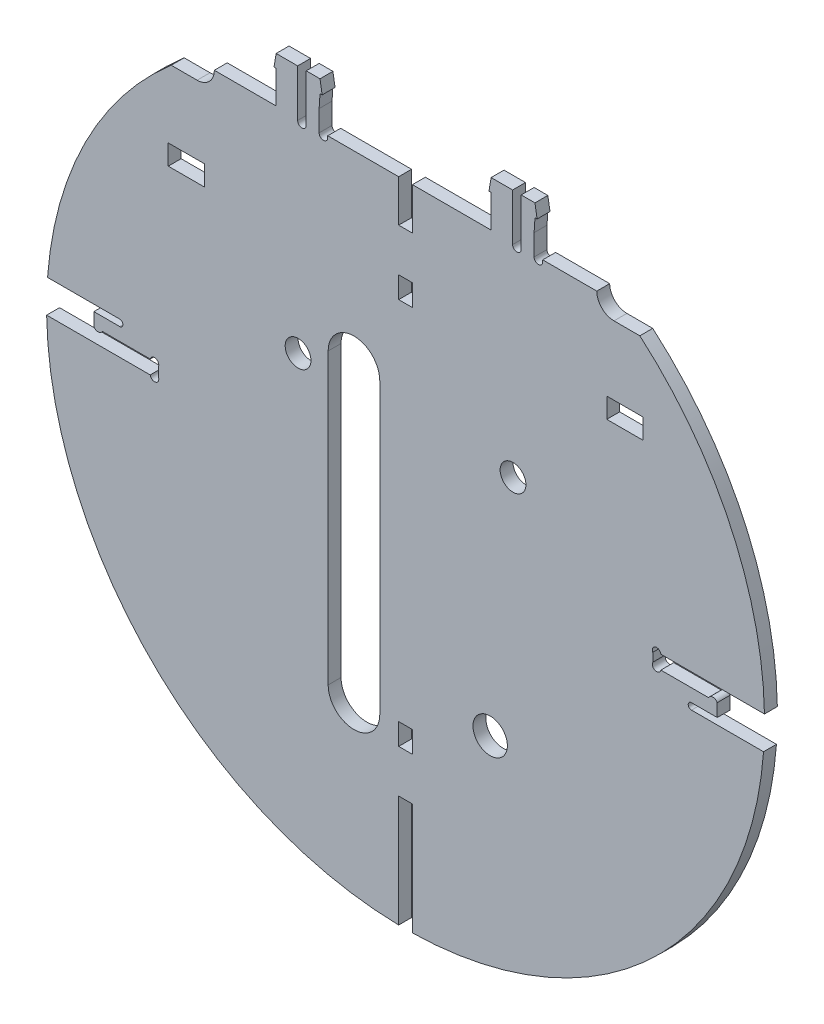
from build123d import *

# Parameters (mm, degrees)
SKETCH1_R                     = 83.5
BOSS_EXTRUDE1_DEPTH           = 3
FACE_FLATTENING_REACH         = 120.125
SKETCH10_W                    = 98.960633138
SKETCH10_H                    = 16.23969765
SIDE_RIB_SLOT_DEPTH           = 10
RIB_TAB_CLEARANCE_SLOT_REACH  = 120.125
SKETCH5_W                     = 3.2
SKETCH5_H                     = 5
SKETCH5_H_2                   = 26
SIDE_RIB_SLOT_PATTERN_COUNT   = 2
EYE_PLATE_SLOTS_REACH         = 120.104
SKETCH3_R                     = 3
SKETCH3_W                     = 8.4
SKETCH3_H                     = 4.684444021
FACE_START                    = -3
FACE_PLATE_TABS_OUTLINE_W     = 2
FACE_PLATE_TABS_OUTLINE_H     = 4.476977338
FACE_PLATE_TABS_DEPTH         = 3
SKETCH11_W                    = 2
SKETCH11_H                    = 4.476977338
FACE_PLATE_TAB_RELIEF_DEPTH   = 3
ACTUATOR_CLEARANCE_SLOT_REACH = 120.104
SKETCH4_R                     = 4
EYE_PLATE_RELIEF_REACH        = 120.104


# Read off the part's stored shape, not the designer's step: face plate tabs
with BuildPart() as part:
    # Sketch1 → Boss-Extrude1 (new body)
    with BuildSketch(Plane.XY):
        Circle(SKETCH1_R)
    extrude(amount=BOSS_EXTRUDE1_DEPTH)

    # Sketch10 → face flattening (cut, up to next)
    with BuildSketch(Plane.XY.offset(3), mode=Mode.PRIVATE) as face_flattening_sk1:
        with Locations((0, 75.380151175)):
            Rectangle(SKETCH10_W, SKETCH10_H)
    face_flattening_tool1 = extrude(face_flattening_sk1.sketch, amount=-FACE_FLATTENING_REACH, mode=Mode.PRIVATE) & part.part
    add(face_flattening_tool1.solids().sort_by_distance((0, 75.380151, 3))[0], mode=Mode.SUBTRACT)

    # Sketch7 → side rib slot (cut)
    with BuildSketch(Plane.XY.offset(3)):
        with BuildLine():
            Line((-72.5, 1.635889894), (-72.5, 4.635889894))
            Line((-72.5, 4.635889894), (-66.5, 4.635889894))
            ThreePointArc((-66.5, 4.635889894), (-65.75, 5.385889894), (-66.5, 6.135889894))
            Line((-66.5, 6.135889894), (-87.5, 6.135889894))
            Line((-87.5, 6.135889894), (-87.5, -1.564110106))
            Line((-87.5, -1.564110106), (-72.5, -1.564110106))
            Line((-72.5, -1.564110106), (-59.391745722, -1.564110106))
            ThreePointArc((-59.391745722, -1.564110106), (-58.11423896, -2.394190801), (-57.5, -1))
            Line((-57.5, -1), (-57.5, 1))
            ThreePointArc((-57.5, 1), (-58.079561495, 2.383159214), (-59.379795897, 1.635889894))
            Line((-59.379795897, 1.635889894), (-70.5, 1.635889894))
            ThreePointArc((-70.5, 1.635889894), (-71.5, 1.035889894), (-72.5, 1.635889894))
        make_face()
    side_rib_slot = extrude(amount=-SIDE_RIB_SLOT_DEPTH, mode=Mode.SUBTRACT)

    # Sketch5 → rib tab clearance slot (cut, up to next)
    with BuildSketch(Plane.XY.offset(3), mode=Mode.PRIVATE) as rib_tab_clearance_slot_sk1:
        with Locations((0, 45)):
            Rectangle(SKETCH5_W, SKETCH5_H)
    rib_tab_clearance_slot_tool1 = extrude(rib_tab_clearance_slot_sk1.sketch, amount=-RIB_TAB_CLEARANCE_SLOT_REACH, mode=Mode.PRIVATE) & part.part
    # Sketch5 → rib tab clearance slot (cut, up to next)
    with BuildSketch(Plane.XY.offset(3), mode=Mode.PRIVATE) as rib_tab_clearance_slot_sk2:
        with Locations((0, 70.5)):
            Rectangle(SKETCH5_W, SKETCH5_H_2)
    rib_tab_clearance_slot_tool2 = extrude(rib_tab_clearance_slot_sk2.sketch, amount=-RIB_TAB_CLEARANCE_SLOT_REACH, mode=Mode.PRIVATE) & part.part
    # Sketch5 → rib tab clearance slot (cut, up to next)
    with BuildSketch(Plane.XY.offset(3), mode=Mode.PRIVATE) as rib_tab_clearance_slot_sk3:
        with Locations((0, -70.5)):
            Rectangle(SKETCH5_W, SKETCH5_H_2)
    rib_tab_clearance_slot_tool3 = extrude(rib_tab_clearance_slot_sk3.sketch, amount=-RIB_TAB_CLEARANCE_SLOT_REACH, mode=Mode.PRIVATE) & part.part
    # Sketch5 → rib tab clearance slot (cut, up to next)
    with BuildSketch(Plane.XY.offset(3), mode=Mode.PRIVATE) as rib_tab_clearance_slot_sk4:
        with Locations((0, -45)):
            Rectangle(SKETCH5_W, SKETCH5_H)
    rib_tab_clearance_slot_tool4 = extrude(rib_tab_clearance_slot_sk4.sketch, amount=-RIB_TAB_CLEARANCE_SLOT_REACH, mode=Mode.PRIVATE) & part.part
    add(rib_tab_clearance_slot_tool1.solids().sort_by_distance((0, 45, 3))[0], mode=Mode.SUBTRACT)
    add(rib_tab_clearance_slot_tool2.solids().sort_by_distance((0, 70.5, 3))[0], mode=Mode.SUBTRACT)
    add(rib_tab_clearance_slot_tool3.solids().sort_by_distance((0, -70.5, 3))[0], mode=Mode.SUBTRACT)
    add(rib_tab_clearance_slot_tool4.solids().sort_by_distance((0, -45, 3))[0], mode=Mode.SUBTRACT)

    # side rib slot pattern: side rib slot ×2 about axis
    side_rib_slot_pattern_axis = Axis((0, 0, 0), (0, 0, 1))
    for i in range(1, SIDE_RIB_SLOT_PATTERN_COUNT):
        add(side_rib_slot.rotate(side_rib_slot_pattern_axis, i * 360 / SIDE_RIB_SLOT_PATTERN_COUNT), mode=Mode.SUBTRACT)

    # Sketch3 → eye plate slots (cut, up to next)
    with BuildSketch(Plane.XY.offset(3), mode=Mode.PRIVATE) as eye_plate_slots_sk1:
        with Locations((-25, 20)):
            Circle(SKETCH3_R)
    eye_plate_slots_tool1 = extrude(eye_plate_slots_sk1.sketch, amount=-EYE_PLATE_SLOTS_REACH, mode=Mode.PRIVATE) & part.part
    # Sketch3 → eye plate slots (cut, up to next)
    with BuildSketch(Plane.XY.offset(3), mode=Mode.PRIVATE) as eye_plate_slots_sk2:
        with Locations((25, 20)):
            Circle(SKETCH3_R)
    eye_plate_slots_tool2 = extrude(eye_plate_slots_sk2.sketch, amount=-EYE_PLATE_SLOTS_REACH, mode=Mode.PRIVATE) & part.part
    # Sketch3 → eye plate slots (cut, up to next)
    with BuildSketch(Plane.XY.offset(3), mode=Mode.PRIVATE) as eye_plate_slots_sk3:
        with Locations((-51, 44.926435594)):
            Rectangle(SKETCH3_W, SKETCH3_H)
    eye_plate_slots_tool3 = extrude(eye_plate_slots_sk3.sketch, amount=-EYE_PLATE_SLOTS_REACH, mode=Mode.PRIVATE) & part.part
    # Sketch3 → eye plate slots (cut, up to next)
    with BuildSketch(Plane.XY.offset(3), mode=Mode.PRIVATE) as eye_plate_slots_sk4:
        with Locations((51, 44.926435594)):
            Rectangle(SKETCH3_W, SKETCH3_H)
    eye_plate_slots_tool4 = extrude(eye_plate_slots_sk4.sketch, amount=-EYE_PLATE_SLOTS_REACH, mode=Mode.PRIVATE) & part.part
    add(eye_plate_slots_tool1.solids().sort_by_distance((-25, 20, 3))[0], mode=Mode.SUBTRACT)
    add(eye_plate_slots_tool2.solids().sort_by_distance((25, 20, 3))[0], mode=Mode.SUBTRACT)
    add(eye_plate_slots_tool3.solids().sort_by_distance((-51, 44.926436, 3))[0], mode=Mode.SUBTRACT)
    add(eye_plate_slots_tool4.solids().sort_by_distance((51, 44.926436, 3))[0], mode=Mode.SUBTRACT)

    # face plate tabs outline → face plate tabs (add)
    with BuildSketch(Plane.XY.offset(3).offset(FACE_START)):
        Polygon((24.9, 67.26030235), (24.9, 77.837279688), (19.9, 77.837279688), (19.4, 74.837279688), (19.9, 74.837279688), (19.9, 71.737279688), (17.9, 71.737279688), (17.9, 67.26030235), align=None)
        with Locations((32.9, 69.498791019)):
            Rectangle(FACE_PLATE_TABS_OUTLINE_W, FACE_PLATE_TABS_OUTLINE_H)
        Polygon((26.9, 77.837279688), (26.9, 67.26030235), (29.9, 67.26030235), (29.9, 71.737279688), (30.1, 74.837279688), (30.6, 74.837279688), (30.1, 77.837279688), align=None)
        Polygon((-25.1, 67.26030235), (-25.1, 77.837279688), (-30.1, 77.837279688), (-30.6, 74.837279688), (-30.1, 74.837279688), (-30.1, 71.737279688), (-32.1, 71.737279688), (-32.1, 67.26030235), align=None)
        with Locations((-17.1, 69.498791019)):
            Rectangle(FACE_PLATE_TABS_OUTLINE_W, FACE_PLATE_TABS_OUTLINE_H)
        Polygon((-23.1, 77.837279688), (-23.1, 67.26030235), (-20.1, 67.26030235), (-20.1, 71.737279688), (-19.9, 74.837279688), (-19.4, 74.837279688), (-19.9, 77.837279688), align=None)
    extrude(amount=FACE_PLATE_TABS_DEPTH)

    # Sketch11 → face plate tab relief (cut)
    with BuildSketch(Plane.XY.offset(3).offset(FACE_START)):
        with BuildLine():
            Line((29.9, 66.837279688), (29.9, 67.26030235))
            Line((29.9, 67.26030235), (31.9, 71.737279688))
            Line((31.9, 71.737279688), (33.9, 71.737279688))
            Line((33.9, 71.737279688), (33.9, 67.26030235))
            Line((33.9, 67.26030235), (31.9, 67.26030235))
            Line((31.9, 67.26030235), (31.9, 66.837279688))
            ThreePointArc((31.9, 66.837279688), (30.9, 65.837279688), (29.9, 66.837279688))
        make_face()
        with BuildLine():
            Line((24.9, 66.837279688), (24.9, 67.26030235))
            Line((24.9, 67.26030235), (26.9, 67.26030235))
            Line((26.9, 67.26030235), (26.9, 66.837279688))
            ThreePointArc((26.9, 66.837279688), (25.9, 65.837279688), (24.9, 66.837279688))
        make_face()
        with Locations((18.9, 69.498791019)):
            Rectangle(SKETCH11_W, SKETCH11_H)
        with BuildLine():
            Line((-25.1, 66.837279688), (-25.1, 67.26030235))
            Line((-25.1, 67.26030235), (-23.1, 67.26030235))
            Line((-23.1, 67.26030235), (-23.1, 66.837279688))
            ThreePointArc((-23.1, 66.837279688), (-24.1, 65.837279688), (-25.1, 66.837279688))
        make_face()
        with BuildLine():
            Line((-20.1, 66.837279688), (-20.1, 67.26030235))
            Line((-20.1, 67.26030235), (-18.1, 71.737279688))
            Line((-18.1, 71.737279688), (-16.1, 71.737279688))
            Line((-16.1, 71.737279688), (-16.1, 67.26030235))
            Line((-16.1, 67.26030235), (-18.1, 67.26030235))
            Line((-18.1, 67.26030235), (-18.1, 66.837279688))
            ThreePointArc((-18.1, 66.837279688), (-19.1, 65.837279688), (-20.1, 66.837279688))
        make_face()
        with Locations((-31.1, 69.498791019)):
            Rectangle(SKETCH11_W, SKETCH11_H)
    extrude(amount=FACE_PLATE_TAB_RELIEF_DEPTH, mode=Mode.SUBTRACT)

    # Sketch4 → actuator clearance slot (cut, up to next)
    with BuildSketch(Plane.XY.offset(3), mode=Mode.PRIVATE) as actuator_clearance_slot_sk1:
        with Locations((19.684125428, -34.734157019)):
            Circle(SKETCH4_R)
    actuator_clearance_slot_tool1 = extrude(actuator_clearance_slot_sk1.sketch, amount=-ACTUATOR_CLEARANCE_SLOT_REACH, mode=Mode.PRIVATE) & part.part
    # Sketch4 → actuator clearance slot (cut, up to next)
    with BuildSketch(Plane.XY.offset(3), mode=Mode.PRIVATE) as actuator_clearance_slot_sk2:
        with BuildLine():
            Line((-6, 23.963301095), (-6, -43.311948564))
            ThreePointArc((-6, -43.311948564), (-12, -49.311948564), (-18, -43.311948564))
            Line((-18, -43.311948564), (-18, 23.963301095))
            ThreePointArc((-18, 23.963301095), (-12, 29.963301095), (-6, 23.963301095))
        make_face()
    actuator_clearance_slot_tool2 = extrude(actuator_clearance_slot_sk2.sketch, amount=-ACTUATOR_CLEARANCE_SLOT_REACH, mode=Mode.PRIVATE) & part.part
    add(actuator_clearance_slot_tool1.solids().sort_by_distance((19.684125, -34.734157, 3))[0], mode=Mode.SUBTRACT)
    add(actuator_clearance_slot_tool2.solids().sort_by_distance((-12, -9.674324, 3))[0], mode=Mode.SUBTRACT)

    # Sketch12 → eye plate relief (cut, up to next)
    with BuildSketch(Plane.XY.offset(3), mode=Mode.PRIVATE) as eye_plate_relief_sk1:
        with BuildLine():
            Line((54.501230688, 63.26030235), (48.480316569, 63.26030235))
            ThreePointArc((48.480316569, 63.26030235), (45.651889444, 64.431875226), (44.480316569, 67.26030235))
            Line((44.480316569, 67.26030235), (54.501230688, 67.26030235))
            Line((54.501230688, 67.26030235), (54.501230688, 63.26030235))
        make_face()
    eye_plate_relief_tool1 = extrude(eye_plate_relief_sk1.sketch, amount=-EYE_PLATE_RELIEF_REACH, mode=Mode.PRIVATE) & part.part
    # Sketch12 → eye plate relief (cut, up to next)
    with BuildSketch(Plane.XY.offset(3), mode=Mode.PRIVATE) as eye_plate_relief_sk2:
        with BuildLine():
            Line((-54.501230688, 67.26030235), (-44.480316569, 67.26030235))
            ThreePointArc((-44.480316569, 67.26030235), (-45.651889444, 64.431875226), (-48.480316569, 63.26030235))
            Line((-48.480316569, 63.26030235), (-54.501230688, 63.26030235))
            Line((-54.501230688, 63.26030235), (-54.501230688, 67.26030235))
        make_face()
    eye_plate_relief_tool2 = extrude(eye_plate_relief_sk2.sketch, amount=-EYE_PLATE_RELIEF_REACH, mode=Mode.PRIVATE) & part.part
    add(eye_plate_relief_tool1.solids().sort_by_distance((49.876481, 65.36397, 3))[0], mode=Mode.SUBTRACT)
    add(eye_plate_relief_tool2.solids().sort_by_distance((-49.876481, 65.36397, 3))[0], mode=Mode.SUBTRACT)


solid = part.part
